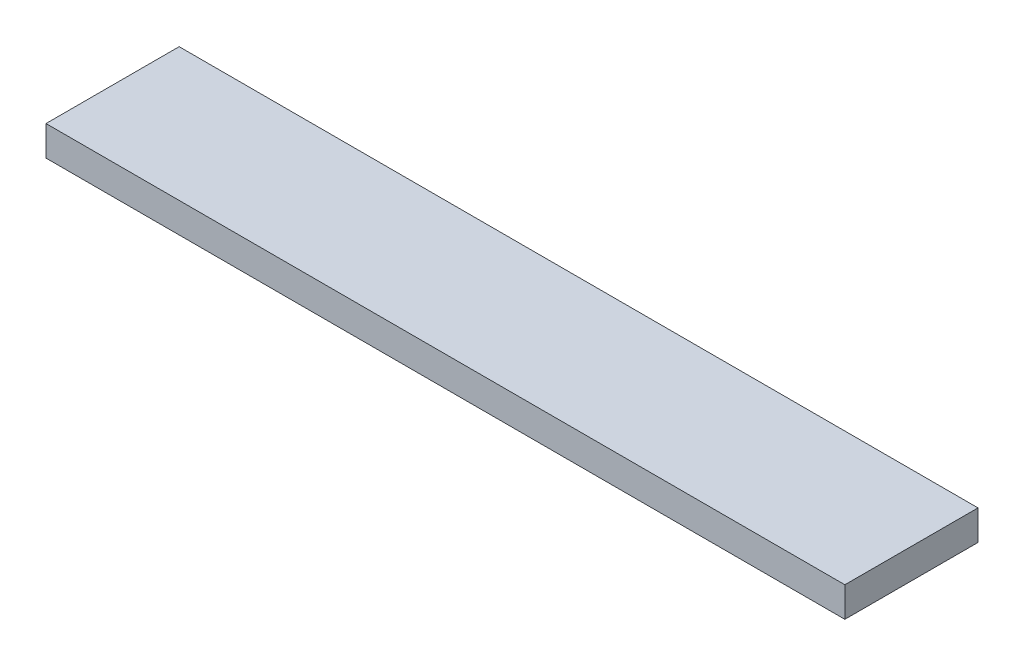
from build123d import *

# Parameters (mm, degrees)
SKETCH1_W           = 120
SKETCH1_H           = 20
BOSS_EXTRUDE1_DEPTH = 4.5


with BuildPart() as part:
    # Sketch1 → Boss-Extrude1 (new body)
    with BuildSketch(Plane(origin=(0, 0, 0), x_dir=(1, 0, 0), z_dir=(0, 1, 0))):
        with Locations((60, 10)):
            Rectangle(SKETCH1_W, SKETCH1_H)
    extrude(amount=BOSS_EXTRUDE1_DEPTH)


solid = part.part
